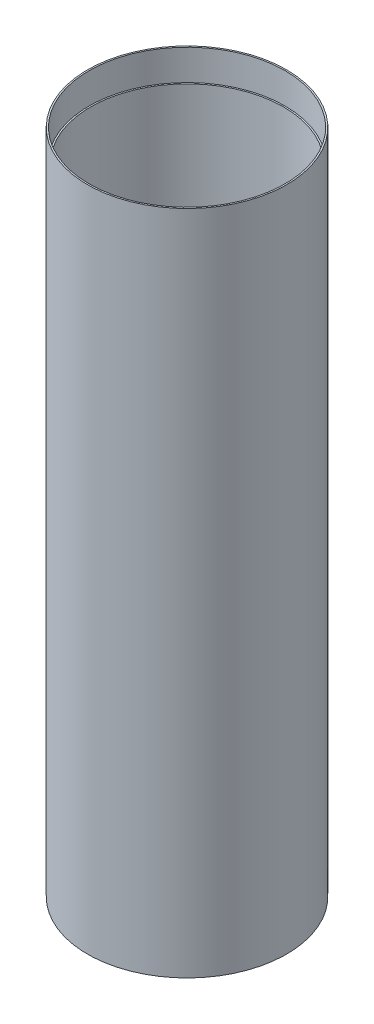
from build123d import *


with BuildPart() as part:
    # Szkic1 → Obrót1 (revolve)
    with BuildSketch(Plane.XY):
        Polygon((64, 217.5), (65, 217.5), (65, -217.5), (64, -217.5), (64, -197.5), (63, -197.5), (63, 197.5), (64, 197.5), align=None)
    revolve(axis=Axis((0, 0, 0), (0, 1, 0)))


solid = part.part
